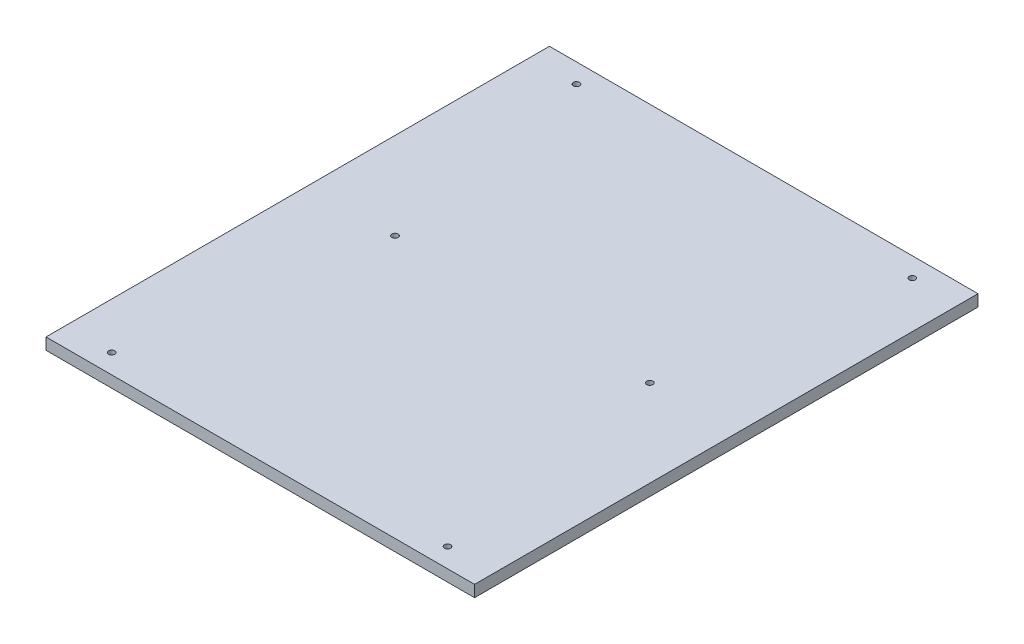
from build123d import *

# Parameters (mm, degrees)
BOSS_EXTRUDE1_DEPTH = 6
SKETCH3_R           = 1.6
SKETCH3_W           = 222
SKETCH3_H           = 30.425305758
CUT_EXTRUDE1_DEPTH  = 10
SKETCH4_R           = 1.6
CUT_EXTRUDE2_DEPTH  = 10


with BuildPart() as part:
    # Sketch1 → Boss-Extrude1 (new body)
    with BuildSketch(Plane(origin=(0, 0, 0), x_dir=(1, 0, 0), z_dir=(0, 1, 0))):
        Polygon((-111, 125.612652879), (111, 125.612652879), (111, -125.612652879), (111, -165.612652879), (-111, -165.612652879), (-111, -125.612652879), align=None)
    extrude(amount=BOSS_EXTRUDE1_DEPTH)

    # Sketch3 → Cut-Extrude1 (cut)
    with BuildSketch(Plane.XZ):
        with Locations((66, 29.812652879)):
            Circle(SKETCH3_R)
        with Locations((-66, 29.812652879)):
            Circle(SKETCH3_R)
        with Locations((0, -110.4)):
            Rectangle(SKETCH3_W, SKETCH3_H)
    extrude(amount=-CUT_EXTRUDE1_DEPTH, mode=Mode.SUBTRACT)

    # Sketch4 → Cut-Extrude2 (cut)
    with BuildSketch(Plane.XZ):
        with Locations((87, 155.612652879)):
            Circle(SKETCH4_R)
        with Locations((-87, 155.612652879)):
            Circle(SKETCH4_R)
        with Locations((87, -85.187347121)):
            Circle(SKETCH4_R)
        with Locations((-87, -85.187347121)):
            Circle(SKETCH4_R)
    extrude(amount=-CUT_EXTRUDE2_DEPTH, mode=Mode.SUBTRACT)


solid = part.part
